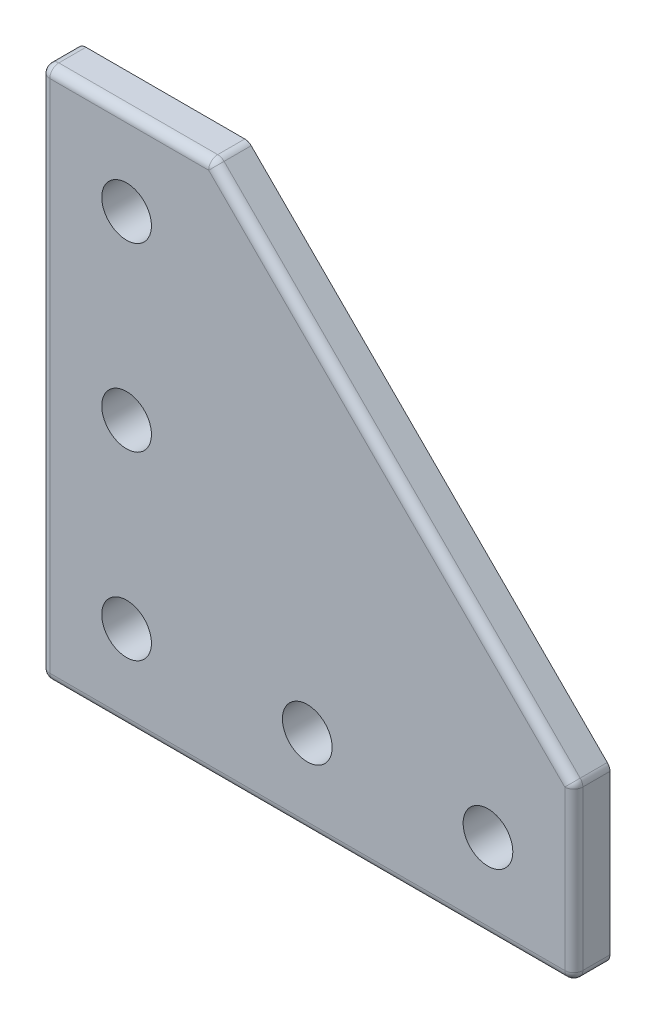
from build123d import *

# Parameters (mm, degrees)
SKETCH1_R           = 2.75
BOSS_EXTRUDE1_DEPTH = 2
FILLET1_R           = 1


with BuildPart() as part:
    # Sketch1 → Boss-Extrude1 (new, symmetric)
    with BuildSketch(Plane.XY):
        Polygon((0, 0), (0, 59), (19, 59), (59, 19), (59, 0), align=None)
        with Locations((9.5, 9.5)):
            Circle(SKETCH1_R, mode=Mode.SUBTRACT)
        with Locations((29.5, 9.5)):
            Circle(SKETCH1_R, mode=Mode.SUBTRACT)
        with Locations((49.5, 9.5)):
            Circle(SKETCH1_R, mode=Mode.SUBTRACT)
        with Locations((9.5, 29.5)):
            Circle(SKETCH1_R, mode=Mode.SUBTRACT)
        with Locations((9.5, 49.5)):
            Circle(SKETCH1_R, mode=Mode.SUBTRACT)
    extrude(amount=BOSS_EXTRUDE1_DEPTH, both=True)

    # Fillet1
    fillet1_edges = [part.edges().sort_by_distance(p)[0] for p in [
        (0, 0, 0),
        (0, 29.5, 2),
        (29.5, 0, 2),
        (59, 9.5, 2),
        (59, 0, 0),
        (9.5, 59, 2),
        (0, 59, 0),
        (39, 39, 2),
        (59, 19, 0),
        (19, 59, 0),
    ]]
    fillet(fillet1_edges, radius=FILLET1_R)


solid = part.part
